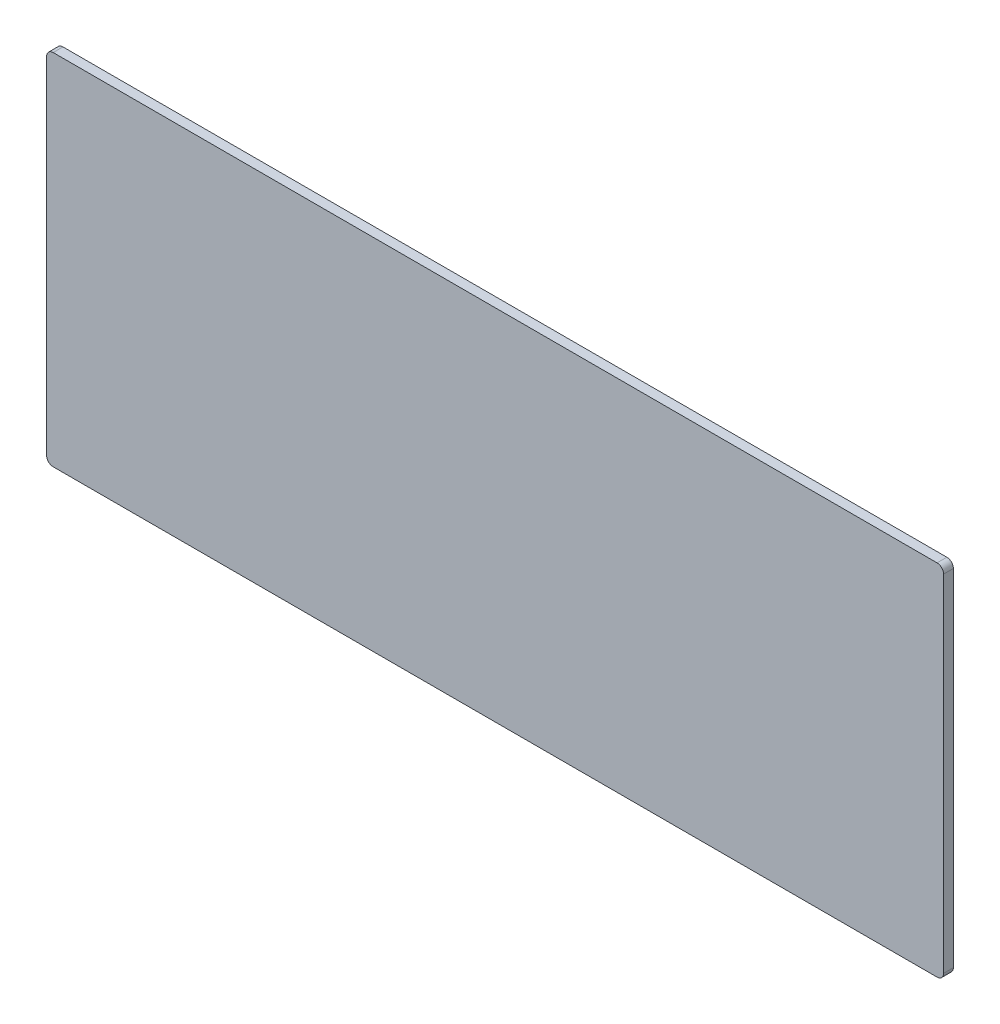
from build123d import *

# Parameters (mm, degrees)
SM_BASE_FLANGE_1_DEPTH = 3


# Sheet-metal steps are written as plain solids
with BuildPart() as part:
    # Sketch 1 → Базовая кромка1 (new body)
    with BuildSketch(Plane.XY):
        with BuildLine():
            Line((-135.5, -37.496099844), (135.5, -37.496099844))
            ThreePointArc((135.5, -37.496099844), (136.914213562, -36.910313406), (137.5, -35.496099844))
            Line((137.5, -35.496099844), (137.5, 70.503900156))
            ThreePointArc((137.5, 70.503900156), (136.914213562, 71.918113718), (135.5, 72.503900156))
            Line((135.5, 72.503900156), (-135.5, 72.503900156))
            ThreePointArc((-135.5, 72.503900156), (-136.914213562, 71.918113718), (-137.5, 70.503900156))
            Line((-137.5, 70.503900156), (-137.5, -35.496099844))
            ThreePointArc((-137.5, -35.496099844), (-136.914213562, -36.910313406), (-135.5, -37.496099844))
        make_face()
    extrude(amount=-SM_BASE_FLANGE_1_DEPTH)


solid = part.part
